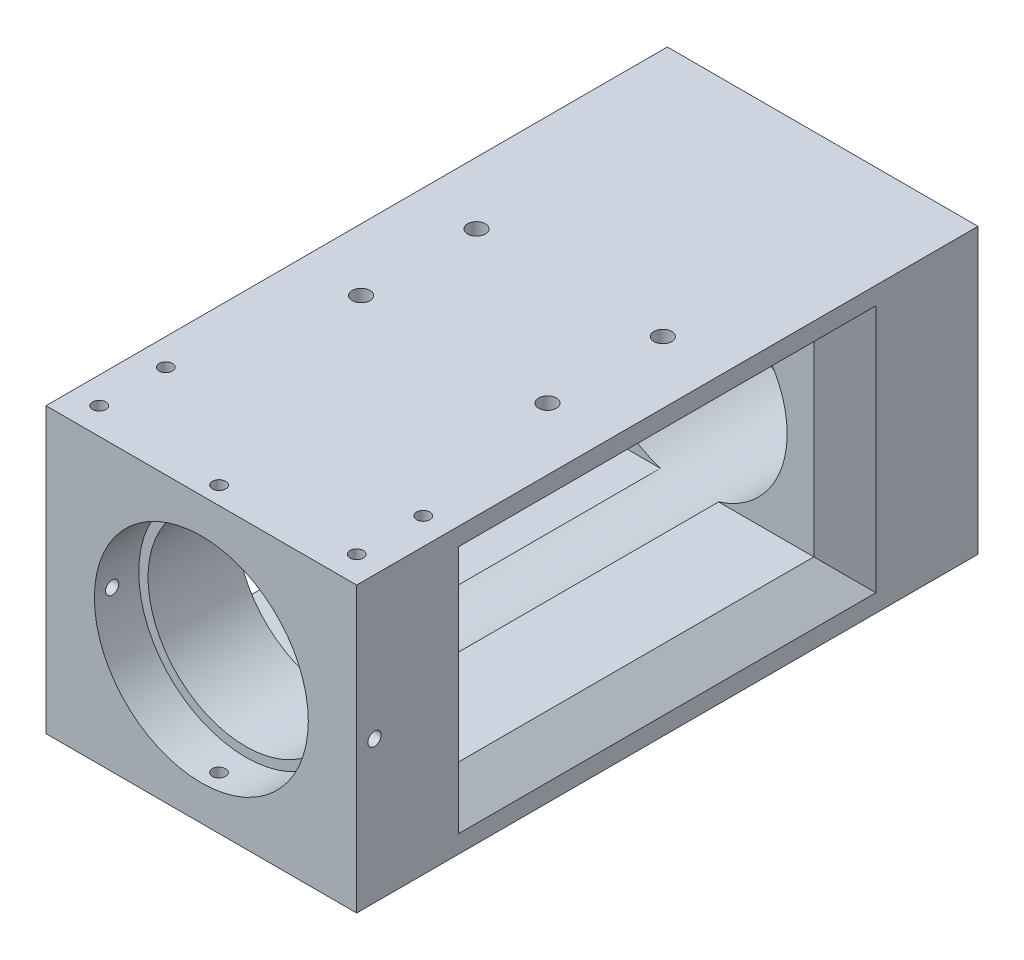
from build123d import *

# Parameters (mm, degrees)
SKETCH_1_W                 = 70
SKETCH_1_H                 = 64
EXTRUDE_1_DEPTH            = 70
SKETCH_2_R                 = 24.1
CUT_EXTRUDE_1_DEPTH        = 10
SKETCH_3_R                 = 1.5
CUT_EXTRUDE_2_DEPTH        = 102.098961419
SKETCH_4_R                 = 1.5
CUT_EXTRUDE_3_DEPTH        = 105.038454527
SKETCH_5_R                 = 22
CUT_EXTRUDE_4_DEPTH        = 139.379911885
SKETCH_6_W                 = 80
SKETCH_6_H                 = 42
CUT_EXTRUDE_5_DEPTH        = 105.038454594
CHAMFER_1_SIZE             = 7
SKETCH_7_R                 = 2
CUT_EXTRUDE_6_DEPTH        = 20
CUT_EXTRUDE_START          = -7
SKETCH_8_R                 = 5.5
SKETCH_8_R_2               = 2
CUT_EXTRUDE_7_DEPTH        = 7
MIRROR_START               = -7
MIRROR_2_COPY_1_SKETCH_R   = 5.5
MIRROR_2_COPY_1_SKETCH_R_2 = 2
MIRROR_2_COPY_1_DEPTH      = 7
SKETCH_11_R                = 1.5
CUT_EXTRUDE_8_DEPTH        = 10


with BuildPart() as part:
    # 草图1 → 凸台-拉伸1 (new, symmetric)
    with BuildSketch(Plane.XY):
        Rectangle(SKETCH_1_W, SKETCH_1_H)
    extrude(amount=EXTRUDE_1_DEPTH, both=True)

    # 草图2 → 切除-拉伸1 (cut)
    with BuildSketch(Plane.XY.offset(70)):
        Circle(SKETCH_2_R)
    extrude(amount=-CUT_EXTRUDE_1_DEPTH, mode=Mode.SUBTRACT)

    # 草图3 → 切除-拉伸2 (cut, through all)
    with BuildSketch(Plane(origin=(0, 32, 0), x_dir=(1, 0, 0), z_dir=(0, 1, 0))):
        with Locations((0, -66)):
            Circle(SKETCH_3_R)
    extrude(amount=-CUT_EXTRUDE_2_DEPTH, mode=Mode.SUBTRACT)

    # 草图4 → 切除-拉伸3 (cut, through all)
    with BuildSketch(Plane(origin=(35, 0, 0), x_dir=(0, 0, -1), z_dir=(1, 0, 0))):
        with Locations((-66, 0)):
            Circle(SKETCH_4_R)
    extrude(amount=-CUT_EXTRUDE_3_DEPTH, mode=Mode.SUBTRACT)

    # 草图5 → 切除-拉伸4 (cut, through all)
    with BuildSketch(Plane.XY.offset(60)):
        Circle(SKETCH_5_R)
    extrude(amount=-CUT_EXTRUDE_4_DEPTH, mode=Mode.SUBTRACT)

    # 草图6 → 切除-拉伸5 (cut, through all)
    with BuildSketch(Plane(origin=(35, 0, 0), x_dir=(0, 0, -1), z_dir=(1, 0, 0))):
        Rectangle(SKETCH_6_W, SKETCH_6_H)
    extrude(amount=-CUT_EXTRUDE_5_DEPTH, mode=Mode.SUBTRACT)

    # 倒角1
    chamfer_1_edges = [part.edges().sort_by_distance(p)[0] for p in [
        (-35, 0, -40),
        (-35, -21, 0),
        (-35, 0, 40),
        (-35, 21, 0),
        (35, 21, 0),
        (35, 0, -40),
        (35, 0, 40),
        (35, -21, 0),
    ]]
    chamfer(chamfer_1_edges, length=CHAMFER_1_SIZE)

    # 草图7 → 切除-拉伸6 (cut)
    with BuildSketch(Plane(origin=(0, 32, 0), x_dir=(1, 0, 0), z_dir=(0, 1, 0))):
        with Locations((-21, 13)):
            Circle(SKETCH_7_R)
        with Locations((21, 13)):
            Circle(SKETCH_7_R)
    cut_extrude_6 = extrude(amount=-CUT_EXTRUDE_6_DEPTH, mode=Mode.SUBTRACT)

    # 草图8 → 切除-拉伸7 (cut)
    with BuildSketch(Plane.XZ.offset(-21).offset(CUT_EXTRUDE_START)):
        with Locations((21, -13)):
            Circle(SKETCH_8_R)
        with Locations((21, -13)):
            Circle(SKETCH_8_R_2, mode=Mode.SUBTRACT)
    cut_extrude_7 = extrude(amount=CUT_EXTRUDE_7_DEPTH, mode=Mode.SUBTRACT)

    # 镜向1: 切除-拉伸7 across plane
    add(cut_extrude_7.mirror(Plane(origin=(0, 0, 0), x_dir=(0, 0, 1), z_dir=(1, 0, 0))), mode=Mode.SUBTRACT)

    # 镜向2: 切除-拉伸6, 切除-拉伸7 across plane
    add(cut_extrude_6.mirror(Plane.XY), mode=Mode.SUBTRACT)
    add(cut_extrude_7.mirror(Plane.XY), mode=Mode.SUBTRACT)

    # 镜向2 copy 1 sketch → 镜向2 copy 1 (cut)
    with BuildSketch(Plane(origin=(0, 21, 0), x_dir=(-1, 0, 0), z_dir=(0, -1, 0)).offset(MIRROR_START)):
        with Locations((21, -13)):
            Circle(MIRROR_2_COPY_1_SKETCH_R)
        with Locations((21, -13)):
            Circle(MIRROR_2_COPY_1_SKETCH_R_2, mode=Mode.SUBTRACT)
    extrude(amount=MIRROR_2_COPY_1_DEPTH, mode=Mode.SUBTRACT)

    # 草图11 → 切除-拉伸8 (cut)
    with BuildSketch(Plane(origin=(0, 32, 0), x_dir=(1, 0, 0), z_dir=(0, 1, 0))):
        with Locations((-29, -64)):
            Circle(SKETCH_11_R)
        with Locations((29, -64)):
            Circle(SKETCH_11_R)
        with Locations((-29, -49)):
            Circle(SKETCH_11_R)
        with Locations((29, -49)):
            Circle(SKETCH_11_R)
    extrude(amount=-CUT_EXTRUDE_8_DEPTH, mode=Mode.SUBTRACT)


solid = part.part
